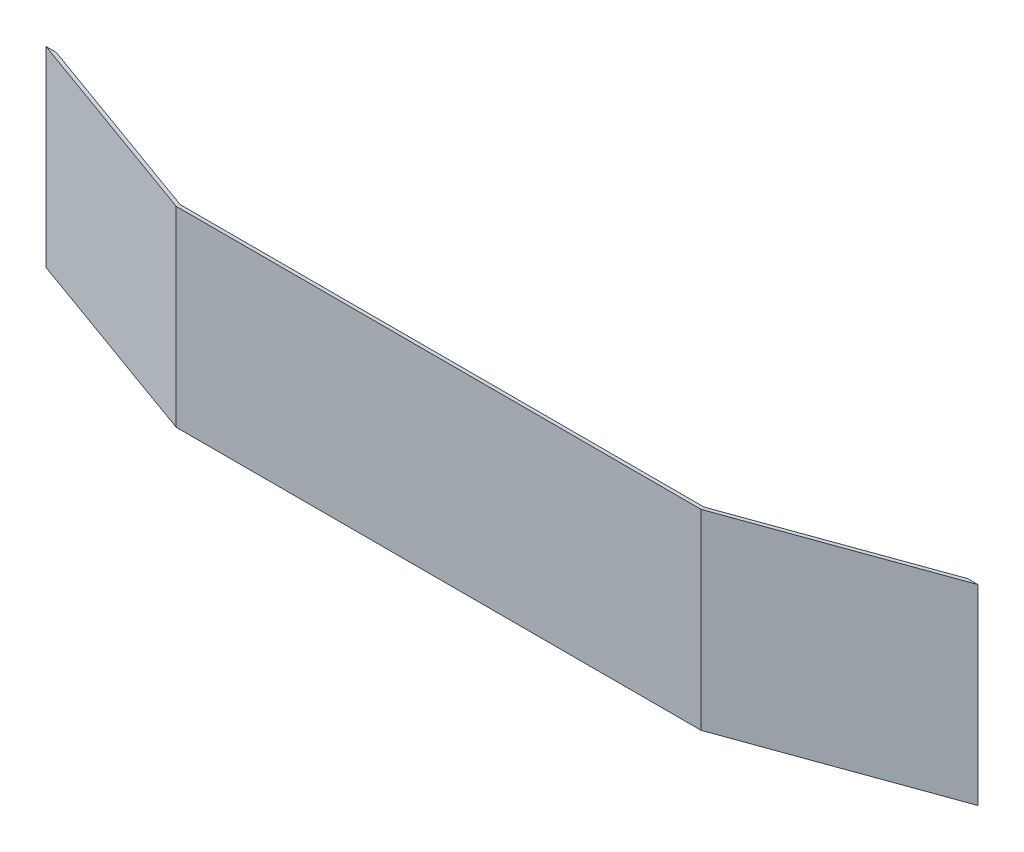
from build123d import *

# Parameters (mm, degrees)
BOSS_EXTRUDE1_DEPTH = 109.600000002


with BuildPart() as part:
    # Sketch1 → Boss-Extrude1 (new body)
    with BuildSketch(Plane(origin=(0, 0, 0), x_dir=(1, 0, 0), z_dir=(0, 1, 0))):
        Polygon((-261, -120), (-150, -160), (150, -160), (261, -120), (266.899364373, -120), (150.349364373, -162), (-150.349364373, -162), (-266.899364373, -120), align=None)
    extrude(amount=BOSS_EXTRUDE1_DEPTH)


solid = part.part
